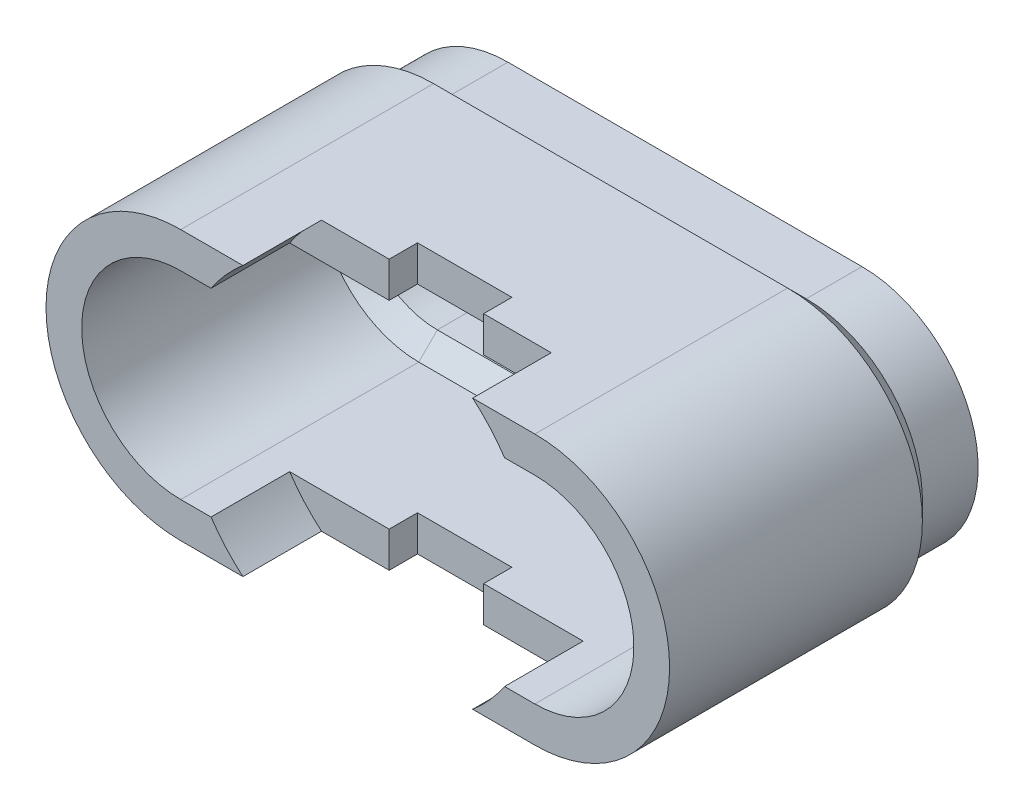
from build123d import *
from OCP.BRepAlgoAPI import BRepAlgoAPI_Cut
from OCP.TopTools import TopTools_ListOfShape

# Parameters (mm, degrees)
BOSS_EXTRUDE1_DEPTH      = 1.5
BOSS_EXTRUDE3_DEPTH      = 0.5
BOSS_EXTRUDE3_DRAFT      = -45
BOSS_EXTRUDE4_DEPTH      = 6.8
SHELL1_T                 = -0.96
SHELL1_THICKNESS_2_DEPTH = 0.46
CUT_EXTRUDE1_START       = -2.114122
CUT_EXTRUDE1_DEPTH       = 2.114122
SKETCH5_W                = 2.54
SKETCH5_H                = 7.2484
CUT_EXTRUDE2_DEPTH       = 0.762


with BuildPart() as part:
    # Sketch2 → Boss-Extrude1 (new body)
    with BuildSketch(Plane.XY):
        with BuildLine():
            Line((-4.7625, -3.1242), (4.7625, -3.1242))
            ThreePointArc((4.7625, -3.1242), (7.8867, 0), (4.7625, 3.1242))
            Line((4.7625, 3.1242), (-4.7625, 3.1242))
            ThreePointArc((-4.7625, 3.1242), (-7.8867, 0), (-4.7625, -3.1242))
        make_face()
    extrude(amount=-BOSS_EXTRUDE1_DEPTH)


with BuildPart() as boss_extrude3_tool:
    # Sketch2<3> → Boss-Extrude3 (with draft: the straight prism first)
    with BuildSketch(Plane.XY):
        with BuildLine():
            Line((-4.7625, -3.1242), (4.7625, -3.1242))
            ThreePointArc((4.7625, -3.1242), (7.8867, 0), (4.7625, 3.1242))
            Line((4.7625, 3.1242), (-4.7625, 3.1242))
            ThreePointArc((-4.7625, 3.1242), (-7.8867, 0), (-4.7625, -3.1242))
        make_face()
    extrude(amount=BOSS_EXTRUDE3_DEPTH)
    # Boss-Extrude3: the draft: its side faces are tilted about the plane it starts from
    boss_extrude3_sides = [boss_extrude3_tool.faces().sort_by_distance(p)[0] for p in [
        (0, -3.1242, 0.25),
        (7.8867, 0, 0.25),
        (0, 3.1242, 0.25),
        (-7.8867, 0, 0.25),
    ]]
    draft(boss_extrude3_sides, Plane.XY, BOSS_EXTRUDE3_DRAFT)


with BuildPart() as part_1:
    add(part.part)

    # Boss-Extrude3: add boss_extrude3_tool
    add(boss_extrude3_tool.part)

    # Sketch3 → Boss-Extrude4 (add)
    with BuildSketch(Plane.XY.offset(0.5)):
        with BuildLine():
            Line((-4.7625, -3.6242), (4.7625, -3.6242))
            ThreePointArc((4.7625, -3.6242), (8.3867, 0), (4.7625, 3.6242))
            Line((4.7625, 3.6242), (-4.7625, 3.6242))
            ThreePointArc((-4.7625, 3.6242), (-8.3867, 0), (-4.7625, -3.6242))
        make_face()
    extrude(amount=BOSS_EXTRUDE4_DEPTH)

    # Shell1
    shell1_openings = [part_1.faces().sort_by_distance(p)[0] for p in [
        (0, 0, 7.3),
    ]]
    offset(amount=SHELL1_T, openings=shell1_openings, kind=Kind.INTERSECTION)

    # Shell1 thickness 2 face (on inner face of the shell) → Shell1 thickness 2 (cut)
    with BuildSketch(Plane(origin=(0, 0, -0.54), x_dir=(-1, 0, 0), z_dir=(0, 0, -1))):
        with BuildLine():
            Line((-4.7625, 2.1642), (4.7625, 2.1642))
            ThreePointArc((4.7625, 2.1642), (6.9267, 0), (4.7625, -2.1642))
            Line((4.7625, -2.1642), (-4.7625, -2.1642))
            ThreePointArc((-4.7625, -2.1642), (-6.9267, 0), (-4.7625, 2.1642))
        make_face()
    extrude(amount=SHELL1_THICKNESS_2_DEPTH, mode=Mode.SUBTRACT)

    # Sketch4 → Cut-Extrude1 (cut)
    with BuildSketch(Plane.XY.offset(7.3).offset(CUT_EXTRUDE1_START)):
        with BuildLine():
            Line((1.3335, 4.572), (-1.3335, 4.572))
            ThreePointArc((-1.3335, 4.572), (-3.367596045, 3.367596045), (-4.572, 1.3335))
            Line((-4.572, 1.3335), (-4.572, -1.3335))
            ThreePointArc((-4.572, -1.3335), (-3.367596045, -3.367596045), (-1.3335, -4.572))
            Line((-1.3335, -4.572), (1.3335, -4.572))
            ThreePointArc((1.3335, -4.572), (3.367596045, -3.367596045), (4.572, -1.3335))
            Line((4.572, -1.3335), (4.572, 1.3335))
            ThreePointArc((4.572, 1.3335), (3.367596045, 3.367596045), (1.3335, 4.572))
        make_face()
    extrude(amount=CUT_EXTRUDE1_DEPTH, mode=Mode.SUBTRACT)


with BuildPart() as cut_extrude2_tool:
    # Sketch5 → Cut-Extrude2 (new body)
    with BuildSketch(Plane.XY.offset(5.185877531)):
        Rectangle(SKETCH5_W, SKETCH5_H)
    extrude(amount=-CUT_EXTRUDE2_DEPTH)


with BuildPart() as part_2:
    add(part_1.part)

    # Cut-Extrude2: cut by cut_extrude2_tool, with a tolerance
    cut_extrude2_stock = TopTools_ListOfShape()
    cut_extrude2_stock.Append(part_2.part.wrapped)
    cut_extrude2_tools = TopTools_ListOfShape()
    cut_extrude2_tools.Append(cut_extrude2_tool.part.wrapped)
    cut_extrude2_cut = BRepAlgoAPI_Cut()
    cut_extrude2_cut.SetArguments(cut_extrude2_stock)
    cut_extrude2_cut.SetTools(cut_extrude2_tools)
    cut_extrude2_cut.SetFuzzyValue(0.00001)
    cut_extrude2_cut.Build()
    add(Compound.cast(cut_extrude2_cut.Shape()).solids(), mode=Mode.REPLACE)


solid = part_2.part
